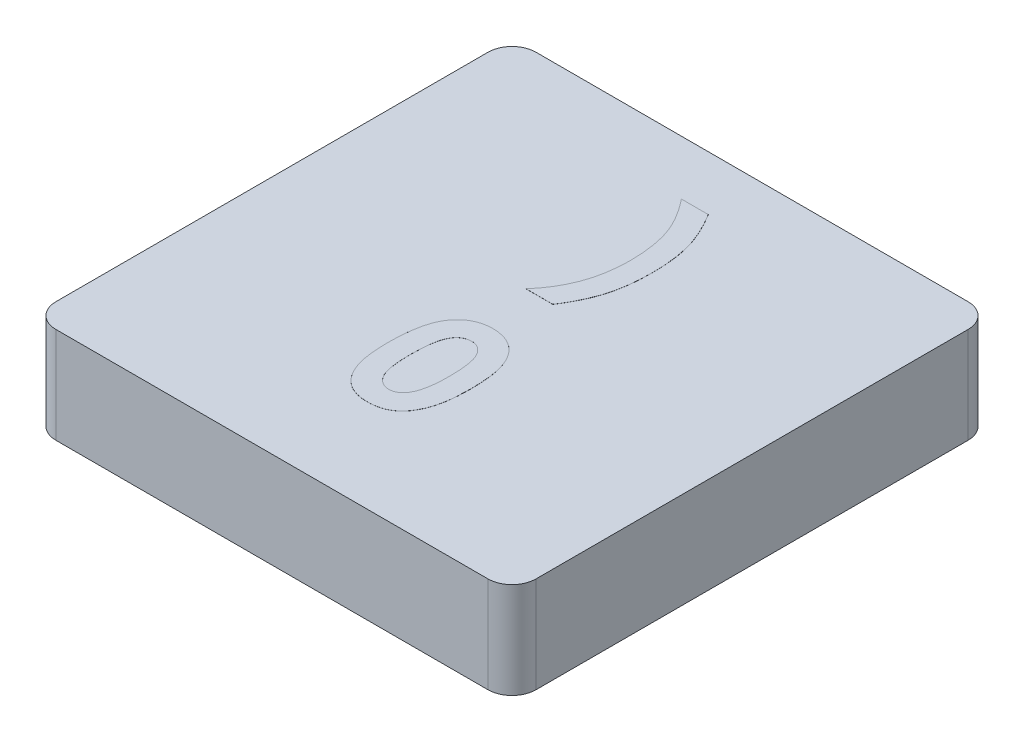
from build123d import *

# Parameters (mm, degrees)
SKETCH1_W           = 12.7
SKETCH1_H           = 12.7
BOSS_EXTRUDE1_DEPTH = 2.54
FILLET1_R           = 0.635
SHELL1_START        = 0.635
SHELL1_OUTLINE_W    = 1.905
SHELL1_OUTLINE_H    = 11.43
SHELL1_DEPTH        = 11.43
SKETCH2_R           = 2.54
BOSS_EXTRUDE2_DEPTH = 1.905
BOSS_EXTRUDE4_DEPTH = 0.00254


# Read off the part's stored shape, not the designer's step: Shell1
with BuildPart() as part:
    # Sketch1 → Boss-Extrude1 (new body)
    with BuildSketch(Plane(origin=(0, 0, 0), x_dir=(1, 0, 0), z_dir=(0, 1, 0))):
        with Locations((6.35, 6.35)):
            Rectangle(SKETCH1_W, SKETCH1_H)
    extrude(amount=BOSS_EXTRUDE1_DEPTH)

    # Fillet1
    fillet1_edges = [part.edges().sort_by_distance(p)[0] for p in [
        (0, 1.27, -12.7),
        (12.7, 1.27, -12.7),
        (12.7, 1.27, 0),
        (0, 1.27, 0),
    ]]
    fillet(fillet1_edges, radius=FILLET1_R)

    # Shell1 outline → Shell1 (cut)
    with BuildSketch(Plane.YZ.offset(SHELL1_START)):
        with Locations((0.9525, -6.35)):
            Rectangle(SHELL1_OUTLINE_W, SHELL1_OUTLINE_H)
    extrude(amount=SHELL1_DEPTH, mode=Mode.SUBTRACT)

    # Sketch2 → Boss-Extrude2 (add)
    with BuildSketch(Plane(origin=(0, 1.905, 0), x_dir=(-1, 0, 0), z_dir=(0, -1, 0))):
        with Locations(Location((-6.35, 6.35, 0), (0, 0, 270))):
            Circle(SKETCH2_R)
    extrude(amount=BOSS_EXTRUDE2_DEPTH)

    # Sketch4 → Boss-Extrude4 (add)
    # profile 1 of 2: a face of its own
    with BuildSketch(Plane(origin=(0, 2.54, 0), x_dir=(1, 0, 0), z_dir=(0, 1, 0))):
        with BuildLine():
            add(Edge.make_bspline(
                [(6.398261018, 5.796410256), (6.425845178, 5.796000762), (6.480083007, 5.795195586), (6.559965119, 5.786474876), (6.636913679, 5.773300314), (6.711229719, 5.754926396), (6.782378305, 5.730609168), (6.850877271, 5.701501864), (6.915911281, 5.666077745), (6.978309727, 5.626064384), (7.038048572, 5.580763586), (7.093692035, 5.529118337), (7.146256284, 5.472316997), (7.194603496, 5.409500832), (7.239804336, 5.34124122), (7.281710281, 5.267527338), (7.32000053, 5.187998406), (7.355104226, 5.102510908), (7.386494062, 5.009783423), (7.412933682, 4.908752326), (7.435610081, 4.799394546), (7.454750561, 4.681437874), (7.46921767, 4.554725518), (7.478968793, 4.419341659), (7.485660475, 4.275547297), (7.486206604, 4.176905546), (7.486487179, 4.126227965)],
                knots=[0, 0, 0, 0, 0.879237366, 1.728815576, 2.559023295, 3.367336655, 4.166867292, 4.954216142, 5.737608147, 6.525189134, 7.316157332, 8.124696809, 8.942788509, 9.781158001, 10.649253743, 11.551476218, 12.482711956, 13.461909668, 14.496590415, 15.601789533, 16.789733467, 18.056700938, 19.410929216, 20.8549011, 22.384193279, 24, 24, 24, 24], degree=3))
            add(Edge.make_bspline(
                [(7.486487179, 4.126227965), (7.486183953, 4.07491635), (7.48559479, 3.975218804), (7.479246968, 3.830109226), (7.468315721, 3.693742398), (7.454226739, 3.56613243), (7.434928689, 3.44734671), (7.412327989, 3.337077662), (7.385471028, 3.235365257), (7.353047221, 3.142438674), (7.318156008, 3.056801041), (7.279761019, 2.977427172), (7.238531471, 2.904102077), (7.195413048, 2.83571955), (7.148041838, 2.77429547), (7.098723532, 2.7177411), (7.045310722, 2.668210667), (6.990052295, 2.623151595), (6.930923911, 2.584211514), (6.868535344, 2.550155161), (6.801774316, 2.522531414), (6.731857766, 2.498505754), (6.657593953, 2.481257923), (6.580162918, 2.467572336), (6.498690481, 2.460008841), (6.443220764, 2.459070539), (6.414797476, 2.458589744)],
                knots=[0, 0, 0, 0, 1.643780988, 3.193836972, 4.651895693, 6.025988579, 7.305620092, 8.505800249, 9.631074763, 10.672816429, 11.65661981, 12.592235626, 13.49536222, 14.350718032, 15.179365177, 15.97804903, 16.751647189, 17.51006938, 18.259804725, 19.016521909, 19.783502495, 20.571750527, 21.382245291, 22.22305063, 23.089471752, 24, 24, 24, 24], degree=3))
            add(Edge.make_bspline(
                [(6.414797476, 2.458589744), (6.386374955, 2.459079814), (6.330695654, 2.460039854), (6.249002907, 2.467516098), (6.171161527, 2.481313364), (6.096310168, 2.49863817), (6.024969783, 2.522478255), (5.956798298, 2.550928485), (5.892319893, 2.584772343), (5.831356037, 2.62380315), (5.774114878, 2.668560743), (5.719706888, 2.718566389), (5.668252422, 2.773693336), (5.620534228, 2.834559051), (5.575770823, 2.900351105), (5.534429016, 2.971820811), (5.496533653, 3.048864109), (5.460899361, 3.131588392), (5.429937671, 3.221774617), (5.402383206, 3.320228137), (5.379811312, 3.427769642), (5.361657484, 3.544364584), (5.347163479, 3.669765951), (5.336381605, 3.804034271), (5.329998525, 3.947232083), (5.32941554, 4.045659072), (5.329115385, 4.096335136)],
                knots=[0, 0, 0, 0, 0.917216111, 1.796812873, 2.643793957, 3.46689424, 4.273913431, 5.068098542, 5.848489301, 6.620921603, 7.401012384, 8.190319798, 9.003608147, 9.831726257, 10.68377682, 11.569763213, 12.493818149, 13.453288342, 14.474581811, 15.568529029, 16.750744269, 18.018426408, 19.375425659, 20.823733699, 22.36466933, 24, 24, 24, 24], degree=3))
            add(Edge.make_bspline(
                [(5.329115385, 4.096335136), (5.329659088, 4.166745538), (5.33070817, 4.302603314), (5.344002911, 4.4988783), (5.36351622, 4.680300526), (5.392176647, 4.846566515), (5.42761487, 4.998292069), (5.472995359, 5.134477699), (5.524657744, 5.257007839), (5.568680734, 5.329595432), (5.589882612, 5.364554287)],
                knots=[0, 0, 0, 0, 1.288568992, 2.486310467, 3.599230591, 4.627010532, 5.572937695, 6.447898582, 7.252493626, 8, 8, 8, 8], degree=3))
            add(Edge.make_bspline(
                [(5.589882612, 5.364554287), (5.614535146, 5.398897855), (5.662735708, 5.466046298), (5.747015739, 5.554199652), (5.837563658, 5.629592717), (5.936239269, 5.690519281), (6.041481976, 5.738565973), (6.154195341, 5.772500812), (6.273963132, 5.792272829), (6.356209672, 5.795010519), (6.398261018, 5.796410256)],
                knots=[0, 0, 0, 0, 1.058512271, 2.069600068, 3.047294572, 4.004278952, 4.967380941, 5.939006123, 6.946246673, 8, 8, 8, 8], degree=3))
        make_face()
        with BuildLine():
            add(Edge.make_bspline(
                [(6.412253405, 5.226538462), (6.387317096, 5.22535653), (6.338428692, 5.223039317), (6.267489289, 5.203369447), (6.200597862, 5.172988272), (6.149715339, 5.136429277), (6.111630277, 5.101383097), (6.085019971, 5.069667444), (6.059358525, 5.034275061), (6.036693044, 4.993608871), (6.015290913, 4.949130059), (5.99437458, 4.900636719), (5.977228679, 4.846937747), (5.960383286, 4.788947646), (5.94562515, 4.725063142), (5.933261068, 4.65476205), (5.922214847, 4.577587196), (5.914509976, 4.49348803), (5.907326724, 4.402552541), (5.902177429, 4.30457816), (5.900024638, 4.199591317), (5.899340331, 4.127288437), (5.898987179, 4.08997496)],
                knots=[0, 0, 0, 0, 1.076674018, 2.110852608, 3.161083442, 4.239746716, 4.804137807, 5.395870207, 6.026861976, 6.692161227, 7.405688833, 8.16177676, 8.973626916, 9.841385931, 10.773283133, 11.807421078, 12.927755683, 14.143907515, 15.458935494, 16.872852025, 18.386167141, 20, 20, 20, 20], degree=3))
            add(Edge.make_bspline(
                [(5.898987179, 4.08997496), (5.899568424, 4.041633547), (5.900683003, 3.948935302), (5.906520648, 3.815631999), (5.918221723, 3.69431526), (5.932775497, 3.584162875), (5.953216868, 3.485889213), (5.976735988, 3.398564514), (6.00578001, 3.323301955), (6.039345974, 3.25901307), (6.076521792, 3.20432265), (6.116877777, 3.157835547), (6.159039953, 3.117579908), (6.204324339, 3.084880749), (6.252622899, 3.059821621), (6.303532431, 3.041796899), (6.357085284, 3.030763217), (6.393757727, 3.0292332), (6.412253405, 3.028461538)],
                knots=[0, 0, 0, 0, 1.771748488, 3.397459088, 4.888034009, 6.237357457, 7.467047327, 8.564189669, 9.548206622, 10.417051504, 11.216568818, 11.965764335, 12.669334354, 13.348544111, 14.005342236, 14.656555988, 15.322436492, 16, 16, 16, 16], degree=3))
            add(Edge.make_bspline(
                [(6.412253405, 3.028461538), (6.430114371, 3.028989566), (6.465083921, 3.03002338), (6.516077356, 3.040635332), (6.564300371, 3.057888063), (6.609607367, 3.082293261), (6.6521604, 3.113328205), (6.691751497, 3.151129275), (6.72808207, 3.19607326), (6.749248427, 3.229428344), (6.760155048, 3.246615585)],
                knots=[0, 0, 0, 0, 0.992283464, 1.942767638, 2.88273346, 3.832339453, 4.79467288, 5.803907806, 6.868395428, 8, 8, 8, 8], degree=3))
            add(Edge.make_bspline(
                [(6.760155048, 3.246615585), (6.772995758, 3.2701014), (6.799921685, 3.31934925), (6.831080414, 3.402453161), (6.857308096, 3.496180636), (6.879881878, 3.600823366), (6.895320968, 3.716794074), (6.908617093, 3.84335738), (6.915030145, 3.981150605), (6.916073263, 4.076614248), (6.916615385, 4.126227965)],
                knots=[0, 0, 0, 0, 0.710965849, 1.490837728, 2.352621235, 3.297892224, 4.334225155, 5.461620853, 6.680770821, 8, 8, 8, 8], degree=3))
            add(Edge.make_bspline(
                [(6.916615385, 4.126227965), (6.916405975, 4.176272352), (6.916002896, 4.272599256), (6.908607571, 4.410887857), (6.898309015, 4.537191543), (6.883245202, 4.65122833), (6.863862868, 4.753275048), (6.839974068, 4.843325026), (6.81181095, 4.921555737), (6.778412849, 4.987889172), (6.741422376, 5.044263493), (6.702155861, 5.092628288), (6.660447267, 5.133920929), (6.616366345, 5.168296808), (6.568892827, 5.194562559), (6.51893352, 5.213108351), (6.466386002, 5.224327934), (6.430541155, 5.225791673), (6.412253405, 5.226538462)],
                knots=[0, 0, 0, 0, 1.793836731, 3.452829483, 4.963243077, 6.335886805, 7.574563692, 8.684454726, 9.672768357, 10.54971625, 11.340229787, 12.085688095, 12.778991901, 13.440269426, 14.083255152, 14.715733572, 15.344777694, 16, 16, 16, 16], degree=3))
        make_face(mode=Mode.SUBTRACT)
    # profile 2 of 2: a face of its own
    with BuildSketch(Plane(origin=(0, 2.54, 0), x_dir=(1, 0, 0), z_dir=(0, 1, 0))):
        with BuildLine():
            Line((6.635113982, 7.146192308), (5.923410256, 7.146192308))
            add(Edge.make_bspline(
                [(5.923410256, 7.146192308), (5.953679146, 7.181290216), (6.01378037, 7.25097983), (6.096686043, 7.360205461), (6.174765109, 7.47089713), (6.246195834, 7.584111892), (6.313174088, 7.69880594), (6.372516205, 7.816577361), (6.426714074, 7.936221038), (6.475466022, 8.058343532), (6.518137971, 8.184013111), (6.555073457, 8.313928294), (6.585942606, 8.44838624), (6.61238286, 8.587037625), (6.631841549, 8.730376742), (6.645493466, 8.878078265), (6.65504572, 9.030163398), (6.655747093, 9.133096248), (6.656102564, 9.185264824)],
                knots=[0, 0, 0, 0, 1.002349761, 1.990243017, 2.964825581, 3.931749288, 4.885124716, 5.836788903, 6.783000779, 7.725738754, 8.680018241, 9.652656607, 10.646069811, 11.663363356, 12.704979249, 13.773722967, 14.871675074, 16, 16, 16, 16], degree=3))
            add(Edge.make_bspline(
                [(6.656102564, 9.185264824), (6.655504819, 9.241459448), (6.654326491, 9.352235286), (6.644613223, 9.515843597), (6.628630271, 9.674087712), (6.607442544, 9.827449848), (6.578495811, 9.975248982), (6.544646715, 10.118127332), (6.503083617, 10.255352681), (6.470591156, 10.344021789), (6.454484976, 10.387974159)],
                knots=[0, 0, 0, 0, 1.099645224, 2.167718429, 3.205979964, 4.211650066, 5.196199703, 6.152169059, 7.084049107, 8, 8, 8, 8], degree=3))
            add(Edge.make_bspline(
                [(6.454484976, 10.387974159), (6.440638281, 10.421840759), (6.412362258, 10.490998979), (6.362103383, 10.594100867), (6.305591359, 10.699504494), (6.242227915, 10.807055281), (6.173177394, 10.917420865), (6.095856119, 11.028926711), (6.012502846, 11.143023006), (5.953507496, 11.21876798), (5.923410256, 11.257410256)],
                knots=[0, 0, 0, 0, 0.858702877, 1.753537788, 2.690942094, 3.665716508, 4.683355137, 5.746314987, 6.850253485, 8, 8, 8, 8], degree=3))
            Line((5.923410256, 11.257410256), (6.635113982, 11.257410256))
            add(Edge.make_bspline(
                [(6.635113982, 11.257410256), (6.661920391, 11.213492953), (6.714541411, 11.12728322), (6.786996906, 10.996963235), (6.853660674, 10.869227811), (6.915298683, 10.744107236), (6.969094753, 10.620310401), (7.017773857, 10.498958472), (7.059699027, 10.379458162), (7.095803158, 10.261062723), (7.126683022, 10.141144178), (7.153117925, 10.017395466), (7.176278336, 9.888486544), (7.194551782, 9.754369656), (7.208353695, 9.614964491), (7.218404888, 9.470527548), (7.225096242, 9.321011847), (7.225678485, 9.21961718), (7.225974359, 9.168092348)],
                knots=[0, 0, 0, 0, 1.119955126, 2.198473562, 3.245059523, 4.256446178, 5.233948972, 6.182657628, 7.102214905, 7.989856078, 8.87639277, 9.796980209, 10.743924827, 11.726870758, 12.742670299, 13.792902966, 14.878438998, 16, 16, 16, 16], degree=3))
            add(Edge.make_bspline(
                [(7.225974359, 9.168092348), (7.225732617, 9.11762546), (7.225255994, 9.018124396), (7.217763031, 8.871367091), (7.207004282, 8.729276077), (7.19286567, 8.591698456), (7.172778877, 8.459001161), (7.149608673, 8.330962218), (7.121482246, 8.207911264), (7.089058186, 8.088778659), (7.050679487, 7.971922405), (7.008520689, 7.854975764), (6.95982626, 7.738072717), (6.90638008, 7.620334191), (6.846325954, 7.502500037), (6.781723934, 7.383431213), (6.710888217, 7.264447508), (6.660564017, 7.18591028), (6.635113982, 7.146192308)],
                knots=[0, 0, 0, 0, 1.131238154, 2.230361439, 3.293294094, 4.325685945, 5.329872518, 6.301220463, 7.242031739, 8.158666971, 9.067978702, 9.998651369, 10.944813546, 11.906133471, 12.896617558, 13.90899238, 14.942532276, 16, 16, 16, 16], degree=3))
        make_face()
    extrude(amount=BOSS_EXTRUDE4_DEPTH)


solid = part.part
